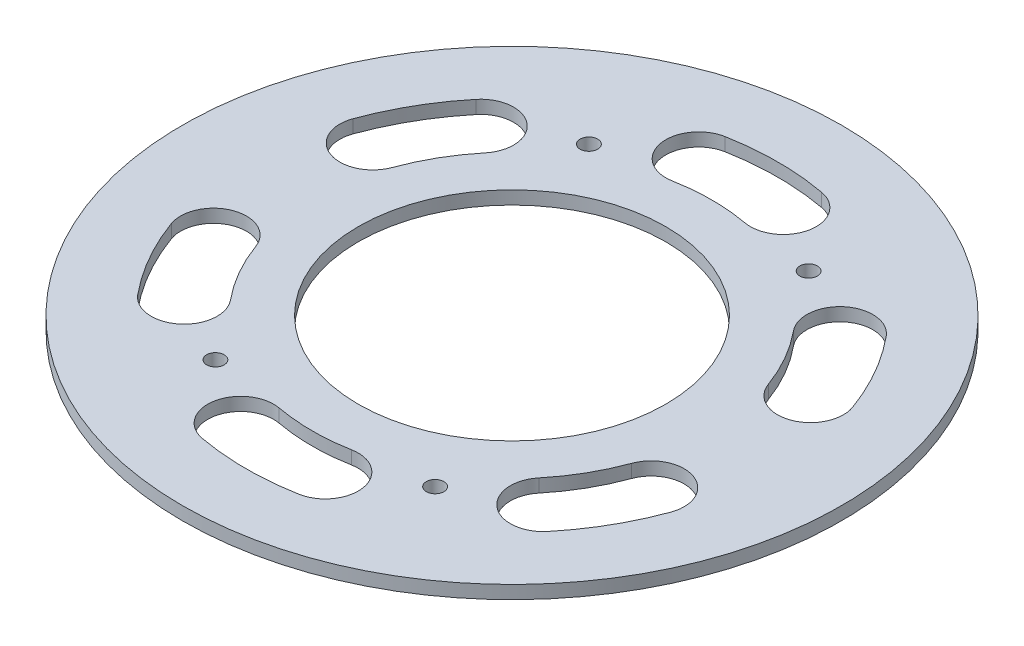
from build123d import *

# Parameters (mm, degrees)
SKETCH_1_R          = 75
SKETCH_1_R_2        = 2
SKETCH_1_R_3        = 35
EXTRUDE_1_DEPTH     = 3
CUT_EXTRUDE_1_DEPTH = 107.108435103


with BuildPart() as part:
    # ｽｹｯﾁ1 → ﾎﾞｽ - 押し出し1 (new body)
    with BuildSketch(Plane(origin=(0, 0, 0), x_dir=(1, 0, 0), z_dir=(0, 1, 0))):
        Circle(SKETCH_1_R)
        with Locations((25, 42.5)):
            Circle(SKETCH_1_R_2, mode=Mode.SUBTRACT)
        with Locations((-25, 42.5)):
            Circle(SKETCH_1_R_2, mode=Mode.SUBTRACT)
        with Locations((25, -42.5)):
            Circle(SKETCH_1_R_2, mode=Mode.SUBTRACT)
        with Locations((-25, -42.5)):
            Circle(SKETCH_1_R_2, mode=Mode.SUBTRACT)
        Circle(SKETCH_1_R_3, mode=Mode.SUBTRACT)
    extrude(amount=EXTRUDE_1_DEPTH)

    # ｽｹｯﾁ2 → ｶｯﾄ - 押し出し1 (cut, through all)
    with BuildSketch(Plane(origin=(0, 3, 0), x_dir=(1, 0, 0), z_dir=(0, 1, 0))):
        with BuildLine():
            ThreePointArc((56.851403558, 20.692218671), (52.51699924, 30.036890499), (46.660137087, 38.510798576))
            ThreePointArc((46.660137087, 38.510798576), (36.101756633, 39.521047152), (35.091508057, 28.962666698))
            ThreePointArc((35.091508057, 28.962666698), (39.496255626, 22.589727566), (42.756014246, 15.561916521))
            ThreePointArc((42.756014246, 15.561916521), (52.368859977, 11.07937294), (56.851403558, 20.692218671))
        make_face()
        with BuildLine():
            ThreePointArc((-10.989474567, -59.493541236), (0, -60.5), (10.989474567, -59.493541236))
            ThreePointArc((10.989474567, -59.493541236), (17.002375394, -50.755977293), (8.264811451, -44.743076466))
            ThreePointArc((8.264811451, -44.743076466), (0, -45.5), (-8.264811451, -44.743076466))
            ThreePointArc((-8.264811451, -44.743076466), (-17.002375394, -50.755977293), (-10.989474567, -59.493541236))
        make_face()
        with BuildLine():
            ThreePointArc((-10.989474567, 59.493541236), (0, 60.5), (10.989474567, 59.493541236))
            ThreePointArc((10.989474567, 59.493541236), (17.002375394, 50.755977293), (8.264811451, 44.743076466))
            ThreePointArc((8.264811451, 44.743076466), (0, 45.5), (-8.264811451, 44.743076466))
            ThreePointArc((-8.264811451, 44.743076466), (-17.002375394, 50.755977293), (-10.989474567, 59.493541236))
        make_face()
        with BuildLine():
            ThreePointArc((56.851403558, -20.692218671), (52.51699924, -30.036890499), (46.660137087, -38.510798576))
            ThreePointArc((46.660137087, -38.510798576), (36.101756633, -39.521047152), (35.091508057, -28.962666698))
            ThreePointArc((35.091508057, -28.962666698), (39.496255626, -22.589727566), (42.756014246, -15.561916521))
            ThreePointArc((42.756014246, -15.561916521), (52.368859977, -11.07937294), (56.851403558, -20.692218671))
        make_face()
        with BuildLine():
            ThreePointArc((-56.851403558, -20.692218671), (-52.51699924, -30.036890499), (-46.660137087, -38.510798576))
            ThreePointArc((-46.660137087, -38.510798576), (-36.101756633, -39.521047152), (-35.091508057, -28.962666698))
            ThreePointArc((-35.091508057, -28.962666698), (-39.496255626, -22.589727566), (-42.756014246, -15.561916521))
            ThreePointArc((-42.756014246, -15.561916521), (-52.368859977, -11.07937294), (-56.851403558, -20.692218671))
        make_face()
        with BuildLine():
            ThreePointArc((-56.851403558, 20.692218671), (-52.51699924, 30.036890499), (-46.660137087, 38.510798576))
            ThreePointArc((-46.660137087, 38.510798576), (-36.101756633, 39.521047152), (-35.091508057, 28.962666698))
            ThreePointArc((-35.091508057, 28.962666698), (-39.496255626, 22.589727566), (-42.756014246, 15.561916521))
            ThreePointArc((-42.756014246, 15.561916521), (-52.368859977, 11.07937294), (-56.851403558, 20.692218671))
        make_face()
    extrude(amount=-CUT_EXTRUDE_1_DEPTH, mode=Mode.SUBTRACT)


solid = part.part
